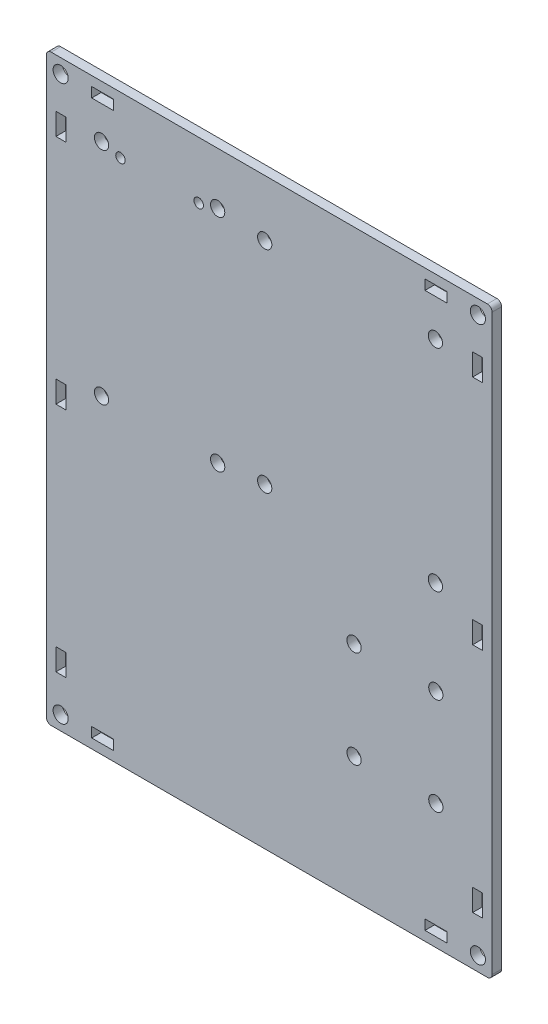
from build123d import *

# Parameters (mm, degrees)
SKETCH1_W           = 94
SKETCH1_H           = 123
SKETCH1_R           = 1.5
SKETCH1_R_2         = 1.6
SKETCH1_W_2         = 2.1
SKETCH1_H_2         = 4.6
SKETCH1_W_3         = 4.6
SKETCH1_H_3         = 2.1
BOSS_EXTRUDE1_DEPTH = 2
FILLET1_R           = 1
SKETCH2_R           = 1
SKETCH2_R_2         = 1.5
CUT_EXTRUDE1_DEPTH  = 10


with BuildPart() as part:
    # Sketch1 → Boss-Extrude1 (new body)
    with BuildSketch(Plane.XY):
        Rectangle(SKETCH1_W, SKETCH1_H)
        with Locations((-35.38, 50.5)):
            Circle(SKETCH1_R, mode=Mode.SUBTRACT)
        with Locations((-10.88, 50.5)):
            Circle(SKETCH1_R, mode=Mode.SUBTRACT)
        with Locations((-35.38, 4)):
            Circle(SKETCH1_R, mode=Mode.SUBTRACT)
        with Locations((-10.88, 4)):
            Circle(SKETCH1_R, mode=Mode.SUBTRACT)
        with Locations((-0.96, 49.58)):
            Circle(SKETCH1_R, mode=Mode.SUBTRACT)
        with Locations((35.04, 49.58)):
            Circle(SKETCH1_R, mode=Mode.SUBTRACT)
        with Locations((-0.96, 5.08)):
            Circle(SKETCH1_R, mode=Mode.SUBTRACT)
        with Locations((35.04, 5.08)):
            Circle(SKETCH1_R, mode=Mode.SUBTRACT)
        with Locations((-44, 58.5)):
            Circle(SKETCH1_R_2, mode=Mode.SUBTRACT)
        with Locations((-44, -58.5)):
            Circle(SKETCH1_R_2, mode=Mode.SUBTRACT)
        with Locations((44, -58.5)):
            Circle(SKETCH1_R_2, mode=Mode.SUBTRACT)
        with Locations((44, 58.5)):
            Circle(SKETCH1_R_2, mode=Mode.SUBTRACT)
        with Locations((-43.95, 0)):
            Rectangle(SKETCH1_W_2, SKETCH1_H_2, mode=Mode.SUBTRACT)
        with Locations((-43.95, -48.9)):
            Rectangle(SKETCH1_W_2, SKETCH1_H_2, mode=Mode.SUBTRACT)
        with Locations((-43.95, 48.9)):
            Rectangle(SKETCH1_W_2, SKETCH1_H_2, mode=Mode.SUBTRACT)
        with Locations((43.95, 48.9)):
            Rectangle(SKETCH1_W_2, SKETCH1_H_2, mode=Mode.SUBTRACT)
        with Locations((43.95, -48.9)):
            Rectangle(SKETCH1_W_2, SKETCH1_H_2, mode=Mode.SUBTRACT)
        with Locations((43.95, 0)):
            Rectangle(SKETCH1_W_2, SKETCH1_H_2, mode=Mode.SUBTRACT)
        with Locations((35.15, 58.45)):
            Rectangle(SKETCH1_W_3, SKETCH1_H_3, mode=Mode.SUBTRACT)
        with Locations((-35.15, 58.45)):
            Rectangle(SKETCH1_W_3, SKETCH1_H_3, mode=Mode.SUBTRACT)
        with Locations((35.15, -58.45)):
            Rectangle(SKETCH1_W_3, SKETCH1_H_3, mode=Mode.SUBTRACT)
        with Locations((-35.15, -58.45)):
            Rectangle(SKETCH1_W_3, SKETCH1_H_3, mode=Mode.SUBTRACT)
    extrude(amount=BOSS_EXTRUDE1_DEPTH)

    # Fillet1
    fillet1_edges = [part.edges().sort_by_distance(p)[0] for p in [
        (47, -61.5, 1),
        (47, 61.5, 1),
        (-47, 61.5, 1),
        (-47, -61.5, 1),
    ]]
    fillet(fillet1_edges, radius=FILLET1_R)

    # Sketch2 → Cut-Extrude1 (cut)
    with BuildSketch(Plane(origin=(0, 0, 0), x_dir=(-1, 0, 0), z_dir=(0, 0, -1))):
        with Locations((31.38, 49.5)):
            Circle(SKETCH2_R)
        with Locations((14.88, 49.5)):
            Circle(SKETCH2_R)
        with Locations((-17.880117234, -35.17015421)):
            Circle(SKETCH2_R_2)
        with Locations((-35.130117234, -35.17015421)):
            Circle(SKETCH2_R_2)
        with Locations((-17.880117234, -14.66984579)):
            Circle(SKETCH2_R_2)
        with Locations((-35.130117234, -14.66984579)):
            Circle(SKETCH2_R_2)
    extrude(amount=-CUT_EXTRUDE1_DEPTH, mode=Mode.SUBTRACT)


solid = part.part
